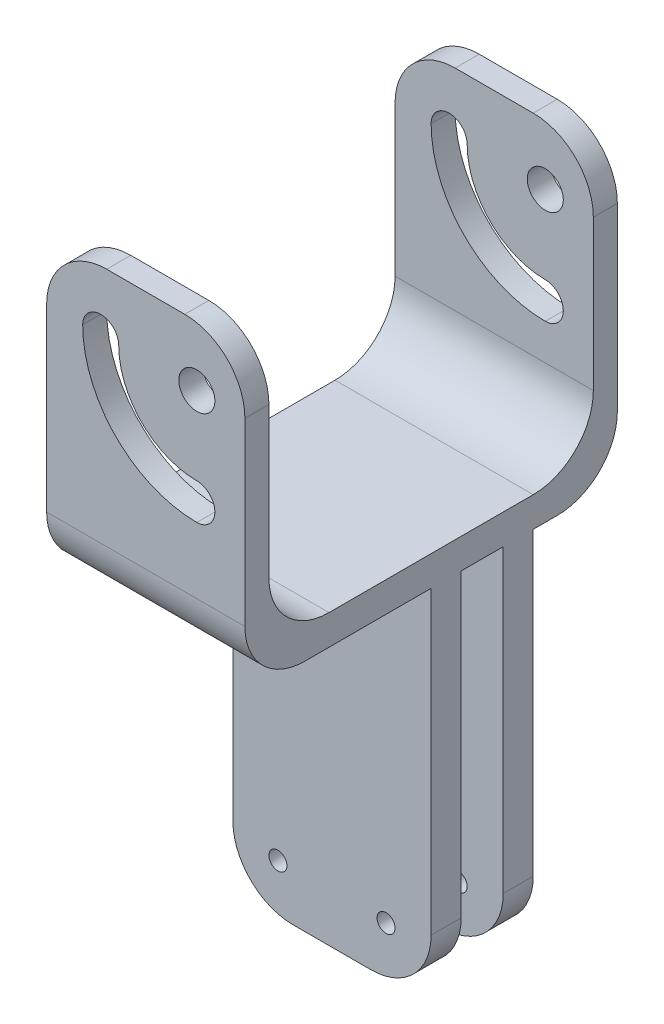
from build123d import *

# Parameters (mm, degrees)
ESBO_O1_W                = 33
ESBO_O1_H                = 50
ESBO_O1_R                = 3
RESSALTO_EXTRUS_O2_DEPTH = 62
ESBO_O3_W                = 33
ESBO_O3_H                = 54
CORTE_EXTRUS_O1_DEPTH    = 45
ESBO_O7_W                = 33
ESBO_O7_H                = 5
RESSALTO_EXTRUS_O3_DEPTH = 60
ESBO_O10_R               = 1.5
CORTE_EXTRUS_O2_DEPTH    = 84.624159189
FILETE1_R                = 10


with BuildPart() as part:
    # Esboço1 → Ressalto-extrusão2 (new body)
    with BuildSketch(Plane.XY):
        with Locations((16.5, 25)):
            Rectangle(ESBO_O1_W, ESBO_O1_H)
        with Locations((25, 40)):
            Circle(ESBO_O1_R, mode=Mode.SUBTRACT)
        with BuildLine():
            ThreePointArc((6, 40), (11.564971157, 26.564971157), (25, 21))
            ThreePointArc((25, 21), (28, 24), (25, 27))
            ThreePointArc((25, 27), (15.807611845, 30.807611845), (12, 40))
            ThreePointArc((12, 40), (9, 43), (6, 40))
        make_face(mode=Mode.SUBTRACT)
    extrude(amount=RESSALTO_EXTRUS_O2_DEPTH)

    # Esboço3 → Corte-extrusão1 (cut)
    with BuildSketch(Plane(origin=(0, 50, 0), x_dir=(1, 0, 0), z_dir=(0, 1, 0))):
        with Locations((16.5, -31)):
            Rectangle(ESBO_O3_W, ESBO_O3_H)
    extrude(amount=-CORTE_EXTRUS_O1_DEPTH, mode=Mode.SUBTRACT)

    # Esboço7 → Ressalto-extrusão3 (add)
    with BuildSketch(Plane.XZ):
        with Locations((16.5, 16.5)):
            Rectangle(ESBO_O7_W, ESBO_O7_H)
        with Locations((16.5, 28.5)):
            Rectangle(ESBO_O7_W, ESBO_O7_H)
    extrude(amount=RESSALTO_EXTRUS_O3_DEPTH)

    # Esboço10 → Corte-extrusão2 (cut, through all)
    with BuildSketch(Plane(origin=(0, 0, 14), x_dir=(-1, 0, 0), z_dir=(0, 0, -1))):
        with Locations((-25.5, -52)):
            Circle(ESBO_O10_R)
        with Locations((-7.5, -52)):
            Circle(ESBO_O10_R)
    extrude(amount=-CORTE_EXTRUS_O2_DEPTH, mode=Mode.SUBTRACT)

    # Filete1
    filete1_edges = [part.edges().sort_by_distance(p)[0] for p in [
        (16.5, 5, 4),
        (0, 50, 2),
        (33, 50, 2),
        (16.5, 5, 58),
        (16.5, 0, 62),
        (16.5, 0, 0),
        (33, -60, 28.5),
        (33, -60, 16.5),
        (0, -60, 16.5),
        (0, -60, 28.5),
        (0, 50, 60),
        (33, 50, 60),
    ]]
    fillet(filete1_edges, radius=FILETE1_R)


solid = part.part
